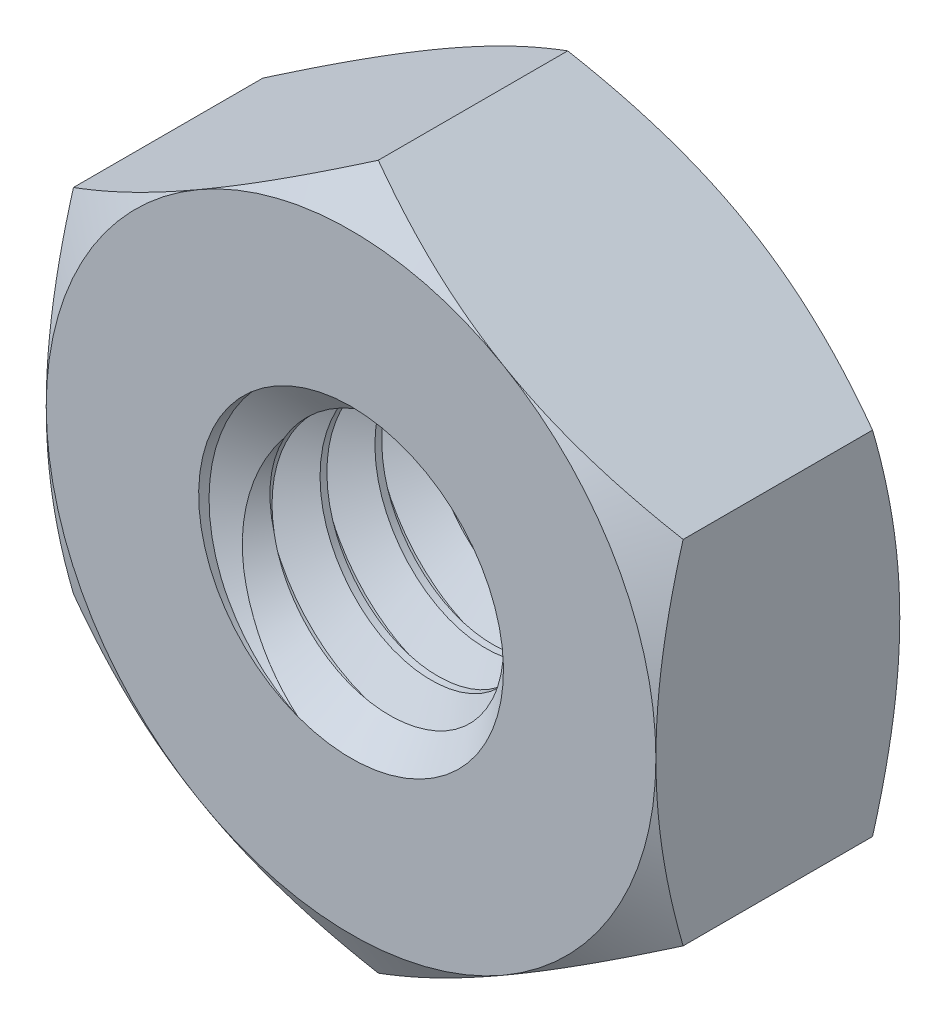
from build123d import *

# Parameters (mm, degrees)
EXTRUDE1_DEPTH          = 1
SKETCH13_R              = 1.25
BOSS_EXTRUDE1_DEPTH     = 2
CUT_SWEEP1_PITCH        = 0.45
SKETCH7_OUTSIDE_W       = 96.568
SKETCH7_OUTSIDE_H       = 97.342
SKETCH7_OUTSIDE_R       = 2.5
EXTRUDE2_DEPTH          = 25.4
EXTRUDE2_DRAFT          = -60
MIRROR2_COPY_1_SKETCH_W = 96.568
MIRROR2_COPY_1_SKETCH_H = 97.342
MIRROR2_COPY_1_SKETCH_R = 2.5
MIRROR2_COPY_1_DEPTH    = 25.4
MIRROR2_COPY_1_DRAFT    = -60


with BuildPart() as part:
    # Sketch1 → Extrude1 (new, symmetric)
    with BuildSketch(Plane.XY):
        Polygon((-2.5, 1.443375673), (-2.5, -1.443375673), (0, -2.886751346), (2.5, -1.443375673), (2.5, 1.443375673), (0, 2.886751346), align=None)
    extrude(amount=EXTRUDE1_DEPTH, both=True)

    # Cut-Extrude2 cone 1 section (through the dimple's axis) → Cut-Extrude2 (revolve, cut)
    with BuildSketch(Plane(origin=(0, 0, 1), x_dir=(0, -1, 0), z_dir=(1, 0, 0))):
        Polygon((0, 0), (1.25, 0), (0, 1.25), align=None)
    revolve(axis=Axis((0, 0, 1), (0, 0, -1)), mode=Mode.SUBTRACT)

    # Cut-Extrude3 cone 1 section (through the dimple's axis) → Cut-Extrude3 (revolve, cut)
    with BuildSketch(Plane(origin=(0, 0, -1), x_dir=(0, 1, 0), z_dir=(1, 0, 0))):
        Polygon((0, 0), (1.25, 0), (0, 1.25), align=None)
    revolve(axis=Axis((0, 0, -1), (0, 0, 1)), mode=Mode.SUBTRACT)


with BuildPart() as body_2:
    # Sketch13 → Boss-Extrude1 (new body)
    with BuildSketch(Plane(origin=(0, 0, -1), x_dir=(-1, 0, 0), z_dir=(0, 0, -1))):
        Circle(SKETCH13_R)
    extrude(amount=-BOSS_EXTRUDE1_DEPTH)

    # Cut-Sweep1: arcs per turn and ends read off the stored shape
    # Cut-Sweep1: the profile of Sketch12 profile screwed along a right-hand helix through 6 turns, 6 arcs to a turn; built about Z, then put on its axis
    cut_sweep1_z = Axis((0, 0, 0), (0, 0, 1))
    cut_sweep1_corners = [(1.2503, 0, -0.843923205), (1.2503, 0, -0.449826795), (0.957716426, 0, -0.61875), (0.957716426, 0, -0.675)]
    with BuildLine(mode=Mode.PRIVATE) as cut_sweep1_profile:
        Line(cut_sweep1_corners[0], cut_sweep1_corners[1])
        Line(cut_sweep1_corners[1], cut_sweep1_corners[2])
        Line(cut_sweep1_corners[2], cut_sweep1_corners[3])
        Line(cut_sweep1_corners[3], cut_sweep1_corners[0])
    cut_sweep1_cap = Face(cut_sweep1_profile.wire())
    cut_sweep1_turn_angles = [0, 30, 60, 90, 120, 150, 180, 210, 240, 270, 300, 330, 360]
    cut_sweep1_turn_weights = [1, 0.8660254037844387, 1, 0.8660254037844387, 1, 0.8660254037844387, 1, 0.8660254037844387, 1, 0.8660254037844387, 1, 0.8660254037844387, 1]
    cut_sweep1_turn_rails = [Edge.make_bspline([Vector(p[0], p[1], 0).rotate(cut_sweep1_z, cut_sweep1_turn_angles[k]) / cut_sweep1_turn_weights[k] + Vector(0, 0, p[2] + CUT_SWEEP1_PITCH * cut_sweep1_turn_angles[k] / 360) for k in range(13)], [0, 0, 0, 1, 1, 2, 2, 3, 3, 4, 4, 5, 5, 6, 6, 6], 2, cut_sweep1_turn_weights) for p in cut_sweep1_corners]
    cut_sweep1_turn_sides = [Face.make_surface_from_curves(cut_sweep1_turn_rails[p[0]], cut_sweep1_turn_rails[p[1]]) for p in [(0, 1), (1, 2), (2, 3), (3, 0)]]
    cut_sweep1 = Plane(origin=(0, 0, -1), x_dir=(0, 1, 0), z_dir=(0, 0, 1)) * Solid(Shell([*[p.moved(Location((0, 0, CUT_SWEEP1_PITCH * i))) for i in range(6) for p in cut_sweep1_turn_sides], cut_sweep1_cap, cut_sweep1_cap.rotate(cut_sweep1_z, 2160).moved(Location((0, 0, CUT_SWEEP1_PITCH * 2160 / 360)))]))
    add(cut_sweep1, mode=Mode.SUBTRACT)


with BuildPart() as part_1:
    add(part.part)

    # Combine1: cut body 2
    add(body_2.part, mode=Mode.SUBTRACT)


with BuildPart() as extrude2_tool:
    # Sketch7 outside → Extrude2 (with draft: the straight prism first)
    with BuildSketch(Plane.XY.offset(1)):
        Rectangle(SKETCH7_OUTSIDE_W, SKETCH7_OUTSIDE_H)
        Circle(SKETCH7_OUTSIDE_R, mode=Mode.SUBTRACT)
    extrude(amount=-EXTRUDE2_DEPTH)
    # Extrude2: the draft: its side faces are tilted about the plane it starts from
    extrude2_sides = [extrude2_tool.faces().sort_by_distance(p)[0] for p in [
        (0, -48.671, -11.7),
        (48.284, 0, -11.7),
        (0, 48.671, -11.7),
        (-48.284, 0, -11.7),
        (-2.5, 0, -11.7),
    ]]
    draft(extrude2_sides, Plane.XY.offset(1), EXTRUDE2_DRAFT)


with BuildPart() as part_2:
    add(part_1.part)

    # Extrude2: cut by extrude2_tool
    add(extrude2_tool.part, mode=Mode.SUBTRACT)


with BuildPart() as mirror2_copy_1_tool:
    # Mirror2 copy 1 sketch → Mirror2 copy 1 (with draft: the straight prism first)
    with BuildSketch(Plane(origin=(0, 0, -1), x_dir=(1, 0, 0), z_dir=(0, 0, -1))):
        Rectangle(MIRROR2_COPY_1_SKETCH_W, MIRROR2_COPY_1_SKETCH_H)
        Circle(MIRROR2_COPY_1_SKETCH_R, mode=Mode.SUBTRACT)
    extrude(amount=-MIRROR2_COPY_1_DEPTH)
    # Mirror2 copy 1: the draft: its side faces are tilted about the plane it starts from
    mirror2_copy_1_sides = [mirror2_copy_1_tool.faces().sort_by_distance(p)[0] for p in [
        (0, -48.671, 11.7),
        (48.284, 0, 11.7),
        (0, 48.671, 11.7),
        (-48.284, 0, 11.7),
        (-2.5, 0, 11.7),
    ]]
    draft(mirror2_copy_1_sides, Plane(origin=(0, 0, -1), x_dir=(1, 0, 0), z_dir=(0, 0, -1)), MIRROR2_COPY_1_DRAFT)


with BuildPart() as part_3:
    add(part_2.part)

    # Mirror2 copy 1: cut by mirror2_copy_1_tool
    add(mirror2_copy_1_tool.part, mode=Mode.SUBTRACT)


solid = part_3.part
